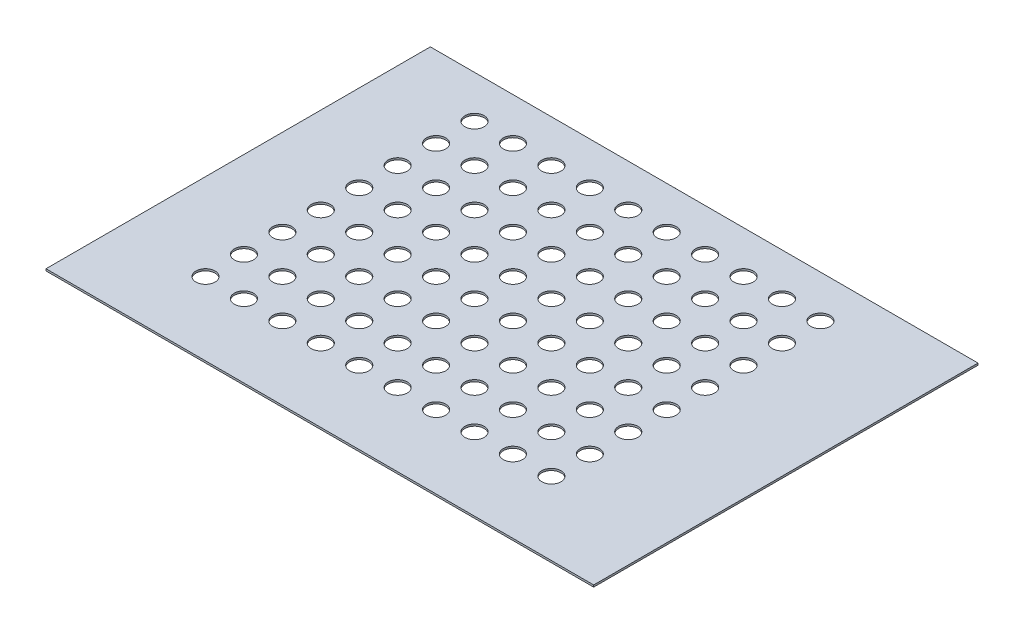
from build123d import *

# Parameters (mm, degrees)
SKETCH1_W          = 285
SKETCH1_H          = 200
BASE_FLANGE1_DEPTH = 1
SKETCH2_R          = 5
CUT_EXTRUDE1_DEPTH = 216.730992495


# Sheet-metal steps are written as plain solids
with BuildPart() as part:
    # Sketch1 → Base-Flange1 (new body)
    with BuildSketch(Plane(origin=(0, 0, 0), x_dir=(1, 0, 0), z_dir=(0, 1, 0))):
        with Locations((33.996598639, -24.047619048)):
            Rectangle(SKETCH1_W, SKETCH1_H)
    extrude(amount=-BASE_FLANGE1_DEPTH)

    # Sketch2 → Cut-Extrude1 (cut, through all)
    with BuildSketch(Plane(origin=(0, 0, 0), x_dir=(1, 0, 0), z_dir=(0, 1, 0))):
        with Locations(Location((-63.503401361, 53.952079096, 0), (0, 0, 270))):
            Circle(SKETCH2_R)
        with Locations(Location((-63.503401361, 33.952079096, 0), (0, 0, 270))):
            Circle(SKETCH2_R)
        with Locations(Location((-63.503401361, 13.952079096, 0), (0, 0, 270))):
            Circle(SKETCH2_R)
        with Locations(Location((-63.503401361, -6.047920904, 0), (0, 0, 270))):
            Circle(SKETCH2_R)
        with Locations(Location((-63.503401361, -26.047920904, 0), (0, 0, 270))):
            Circle(SKETCH2_R)
        with Locations(Location((-63.503401361, -46.047920904, 0), (0, 0, 270))):
            Circle(SKETCH2_R)
        with Locations(Location((-63.503401361, -66.047920904, 0), (0, 0, 270))):
            Circle(SKETCH2_R)
        with Locations(Location((-63.503401361, -86.047920904, 0), (0, 0, 270))):
            Circle(SKETCH2_R)
        with Locations(Location((-43.503401361, 53.952079096, 0), (0, 0, 270))):
            Circle(SKETCH2_R)
        with Locations(Location((-43.503401361, 33.952079096, 0), (0, 0, 270))):
            Circle(SKETCH2_R)
        with Locations(Location((-43.503401361, 13.952079096, 0), (0, 0, 270))):
            Circle(SKETCH2_R)
        with Locations(Location((-43.503401361, -6.047920904, 0), (0, 0, 270))):
            Circle(SKETCH2_R)
        with Locations(Location((-43.503401361, -26.047920904, 0), (0, 0, 270))):
            Circle(SKETCH2_R)
        with Locations(Location((-43.503401361, -46.047920904, 0), (0, 0, 270))):
            Circle(SKETCH2_R)
        with Locations(Location((-43.503401361, -66.047920904, 0), (0, 0, 270))):
            Circle(SKETCH2_R)
        with Locations(Location((-43.503401361, -86.047920904, 0), (0, 0, 270))):
            Circle(SKETCH2_R)
        with Locations(Location((-23.503401361, 53.952079096, 0), (0, 0, 270))):
            Circle(SKETCH2_R)
        with Locations(Location((-23.503401361, 33.952079096, 0), (0, 0, 270))):
            Circle(SKETCH2_R)
        with Locations(Location((-23.503401361, 13.952079096, 0), (0, 0, 270))):
            Circle(SKETCH2_R)
        with Locations(Location((-23.503401361, -6.047920904, 0), (0, 0, 270))):
            Circle(SKETCH2_R)
        with Locations(Location((-23.503401361, -26.047920904, 0), (0, 0, 270))):
            Circle(SKETCH2_R)
        with Locations(Location((-23.503401361, -46.047920904, 0), (0, 0, 270))):
            Circle(SKETCH2_R)
        with Locations(Location((-23.503401361, -66.047920904, 0), (0, 0, 270))):
            Circle(SKETCH2_R)
        with Locations(Location((-23.503401361, -86.047920904, 0), (0, 0, 270))):
            Circle(SKETCH2_R)
        with Locations(Location((-3.503401361, 53.952079096, 0), (0, 0, 270))):
            Circle(SKETCH2_R)
        with Locations(Location((-3.503401361, 33.952079096, 0), (0, 0, 270))):
            Circle(SKETCH2_R)
        with Locations(Location((-3.503401361, 13.952079096, 0), (0, 0, 270))):
            Circle(SKETCH2_R)
        with Locations(Location((-3.503401361, -6.047920904, 0), (0, 0, 270))):
            Circle(SKETCH2_R)
        with Locations(Location((-3.503401361, -26.047920904, 0), (0, 0, 270))):
            Circle(SKETCH2_R)
        with Locations(Location((-3.503401361, -46.047920904, 0), (0, 0, 270))):
            Circle(SKETCH2_R)
        with Locations(Location((-3.503401361, -66.047920904, 0), (0, 0, 270))):
            Circle(SKETCH2_R)
        with Locations(Location((-3.503401361, -86.047920904, 0), (0, 0, 270))):
            Circle(SKETCH2_R)
        with Locations(Location((16.496598639, 53.952079096, 0), (0, 0, 270))):
            Circle(SKETCH2_R)
        with Locations(Location((16.496598639, 33.952079096, 0), (0, 0, 270))):
            Circle(SKETCH2_R)
        with Locations(Location((16.496598639, 13.952079096, 0), (0, 0, 270))):
            Circle(SKETCH2_R)
        with Locations(Location((16.496598639, -6.047920904, 0), (0, 0, 270))):
            Circle(SKETCH2_R)
        with Locations(Location((16.496598639, -26.047920904, 0), (0, 0, 270))):
            Circle(SKETCH2_R)
        with Locations(Location((16.496598639, -46.047920904, 0), (0, 0, 270))):
            Circle(SKETCH2_R)
        with Locations(Location((16.496598639, -66.047920904, 0), (0, 0, 270))):
            Circle(SKETCH2_R)
        with Locations(Location((16.496598639, -86.047920904, 0), (0, 0, 270))):
            Circle(SKETCH2_R)
        with Locations(Location((36.496598639, 53.952079096, 0), (0, 0, 270))):
            Circle(SKETCH2_R)
        with Locations(Location((36.496598639, 33.952079096, 0), (0, 0, 270))):
            Circle(SKETCH2_R)
        with Locations(Location((36.496598639, 13.952079096, 0), (0, 0, 270))):
            Circle(SKETCH2_R)
        with Locations(Location((36.496598639, -6.047920904, 0), (0, 0, 270))):
            Circle(SKETCH2_R)
        with Locations(Location((36.496598639, -26.047920904, 0), (0, 0, 270))):
            Circle(SKETCH2_R)
        with Locations(Location((36.496598639, -46.047920904, 0), (0, 0, 270))):
            Circle(SKETCH2_R)
        with Locations(Location((36.496598639, -66.047920904, 0), (0, 0, 270))):
            Circle(SKETCH2_R)
        with Locations(Location((36.496598639, -86.047920904, 0), (0, 0, 270))):
            Circle(SKETCH2_R)
        with Locations(Location((56.496598639, 53.952079096, 0), (0, 0, 270))):
            Circle(SKETCH2_R)
        with Locations(Location((56.496598639, 33.952079096, 0), (0, 0, 270))):
            Circle(SKETCH2_R)
        with Locations(Location((56.496598639, 13.952079096, 0), (0, 0, 270))):
            Circle(SKETCH2_R)
        with Locations(Location((56.496598639, -6.047920904, 0), (0, 0, 270))):
            Circle(SKETCH2_R)
        with Locations(Location((56.496598639, -26.047920904, 0), (0, 0, 270))):
            Circle(SKETCH2_R)
        with Locations(Location((56.496598639, -46.047920904, 0), (0, 0, 270))):
            Circle(SKETCH2_R)
        with Locations(Location((56.496598639, -66.047920904, 0), (0, 0, 270))):
            Circle(SKETCH2_R)
        with Locations(Location((56.496598639, -86.047920904, 0), (0, 0, 270))):
            Circle(SKETCH2_R)
        with Locations(Location((76.496598639, 53.952079096, 0), (0, 0, 270))):
            Circle(SKETCH2_R)
        with Locations(Location((76.496598639, 33.952079096, 0), (0, 0, 270))):
            Circle(SKETCH2_R)
        with Locations(Location((76.496598639, 13.952079096, 0), (0, 0, 270))):
            Circle(SKETCH2_R)
        with Locations(Location((76.496598639, -6.047920904, 0), (0, 0, 270))):
            Circle(SKETCH2_R)
        with Locations(Location((76.496598639, -26.047920904, 0), (0, 0, 270))):
            Circle(SKETCH2_R)
        with Locations(Location((76.496598639, -46.047920904, 0), (0, 0, 270))):
            Circle(SKETCH2_R)
        with Locations(Location((76.496598639, -66.047920904, 0), (0, 0, 270))):
            Circle(SKETCH2_R)
        with Locations(Location((76.496598639, -86.047920904, 0), (0, 0, 270))):
            Circle(SKETCH2_R)
        with Locations(Location((96.496598639, 53.952079096, 0), (0, 0, 270))):
            Circle(SKETCH2_R)
        with Locations(Location((96.496598639, 33.952079096, 0), (0, 0, 270))):
            Circle(SKETCH2_R)
        with Locations(Location((96.496598639, 13.952079096, 0), (0, 0, 270))):
            Circle(SKETCH2_R)
        with Locations(Location((96.496598639, -6.047920904, 0), (0, 0, 270))):
            Circle(SKETCH2_R)
        with Locations(Location((96.496598639, -26.047920904, 0), (0, 0, 270))):
            Circle(SKETCH2_R)
        with Locations(Location((96.496598639, -46.047920904, 0), (0, 0, 270))):
            Circle(SKETCH2_R)
        with Locations(Location((96.496598639, -66.047920904, 0), (0, 0, 270))):
            Circle(SKETCH2_R)
        with Locations(Location((96.496598639, -86.047920904, 0), (0, 0, 270))):
            Circle(SKETCH2_R)
        with Locations(Location((116.496598639, 53.952079096, 0), (0, 0, 270))):
            Circle(SKETCH2_R)
        with Locations(Location((116.496598639, 33.952079096, 0), (0, 0, 270))):
            Circle(SKETCH2_R)
        with Locations(Location((116.496598639, 13.952079096, 0), (0, 0, 270))):
            Circle(SKETCH2_R)
        with Locations(Location((116.496598639, -6.047920904, 0), (0, 0, 270))):
            Circle(SKETCH2_R)
        with Locations(Location((116.496598639, -26.047920904, 0), (0, 0, 270))):
            Circle(SKETCH2_R)
        with Locations(Location((116.496598639, -46.047920904, 0), (0, 0, 270))):
            Circle(SKETCH2_R)
        with Locations(Location((116.496598639, -66.047920904, 0), (0, 0, 270))):
            Circle(SKETCH2_R)
        with Locations(Location((116.496598639, -86.047920904, 0), (0, 0, 270))):
            Circle(SKETCH2_R)
    extrude(amount=-CUT_EXTRUDE1_DEPTH, mode=Mode.SUBTRACT)


solid = part.part
